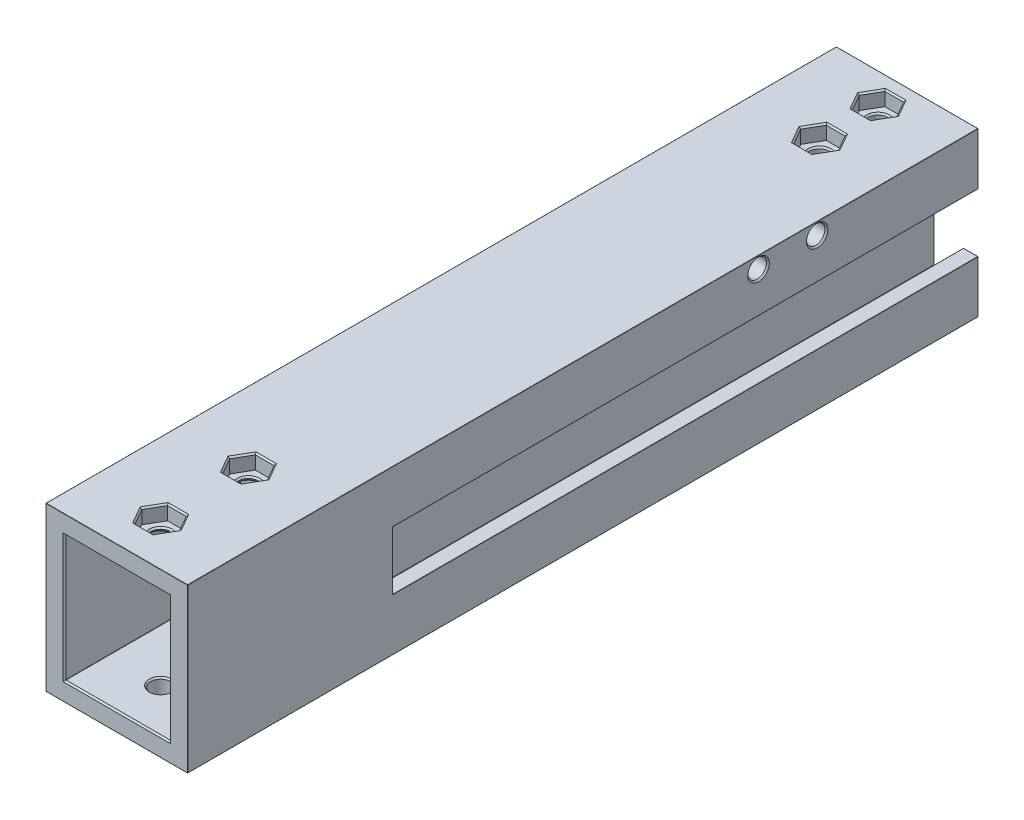
from build123d import *

# Parameters (mm, degrees)
SKETCH1_W           = 48.42
SKETCH1_H           = 55.7
BOSS_EXTRUDE1_DEPTH = 270
SKETCH2_W           = 35.72
SKETCH2_H           = 43
CUT_EXTRUDE1_DEPTH  = 60
SKETCH3_R           = 3.3734375
CUT_EXTRUDE2_DEPTH  = 279.876988832
CUT_EXTRUDE4_DEPTH  = 200
SKETCH11_R          = 3.175
CUT_EXTRUDE5_DEPTH  = 279.711174695
SKETCH12_W          = 15
SKETCH12_H          = 30
CUT_EXTRUDE6_DEPTH  = 50
CUT_EXTRUDE9_DEPTH  = 5
CHAMFER1_SIZE       = 0.5
FILLET7_R           = 0.1


with BuildPart() as part:
    # Sketch1 → Boss-Extrude1 (new body)
    with BuildSketch(Plane.XY):
        with Locations((17.86, 21.5)):
            Rectangle(SKETCH1_W, SKETCH1_H)
    extrude(amount=-BOSS_EXTRUDE1_DEPTH)

    # Sketch2 → Cut-Extrude1 (cut)
    with BuildSketch(Plane.XY):
        with Locations((17.86, 21.5)):
            Rectangle(SKETCH2_W, SKETCH2_H)
    extrude(amount=-CUT_EXTRUDE1_DEPTH, mode=Mode.SUBTRACT)

    # Sketch3 → Cut-Extrude2 (cut, through all)
    with BuildSketch(Plane.XZ.offset(6.35)):
        with Locations((17.86, -260)):
            Circle(SKETCH3_R)
        with Locations((17.86, -240)):
            Circle(SKETCH3_R)
        with Locations((17.86, -45)):
            Circle(SKETCH3_R)
        with Locations((17.86, -15)):
            Circle(SKETCH3_R)
    extrude(amount=-CUT_EXTRUDE2_DEPTH, mode=Mode.SUBTRACT)

    # Sketch8 → Cut-Extrude4 (cut)
    with BuildSketch(Plane(origin=(0, 0, -270), x_dir=(-1, 0, 0), z_dir=(0, 0, -1))):
        Polygon((6.35, 11.5), (1.35, 11.5), (1.35, 1.5), (-8.65, 1.5), (-8.65, 41.5), (1.35, 41.5), (1.35, 31.5), (6.35, 31.5), align=None)
        Polygon((-42.07, 11.5), (-37.07, 11.5), (-37.07, 1.5), (-27.07, 1.5), (-27.07, 41.5), (-37.07, 41.5), (-37.07, 31.5), (-42.07, 31.5), align=None)
    extrude(amount=-CUT_EXTRUDE4_DEPTH, mode=Mode.SUBTRACT)

    # Sketch11 → Cut-Extrude5 (cut, through all)
    with BuildSketch(Plane.ZY.offset(6.35)):
        with Locations((-195, 45.23125)):
            Circle(SKETCH11_R)
        with Locations((-215, 45.23125)):
            Circle(SKETCH11_R)
    extrude(amount=-CUT_EXTRUDE5_DEPTH, mode=Mode.SUBTRACT)

    # Sketch12 → Cut-Extrude6 (cut)
    with BuildSketch(Plane(origin=(0, 0, -270), x_dir=(-1, 0, 0), z_dir=(0, 0, -1))):
        with Locations((-17.86, 21.5)):
            Rectangle(SKETCH12_W, SKETCH12_H)
    extrude(amount=-CUT_EXTRUDE6_DEPTH, mode=Mode.SUBTRACT)

    # Sketch13 → Cut-Extrude9 (cut)
    with BuildSketch(Plane(origin=(0, 49.35, 0), x_dir=(1, 0, 0), z_dir=(0, 1, 0))):
        Polygon((24.275804866, 240), (21.067902433, 245.55625), (14.652097567, 245.55625), (11.444195134, 240), (14.652097567, 234.44375), (21.067902433, 234.44375), align=None)
        Polygon((24.275804866, 260), (21.067902433, 265.55625), (14.652097567, 265.55625), (11.444195134, 260), (14.652097567, 254.44375), (21.067902433, 254.44375), align=None)
        Polygon((24.275804866, 45), (21.067902433, 50.55625), (14.652097567, 50.55625), (11.444195134, 45), (14.652097567, 39.44375), (21.067902433, 39.44375), align=None)
        Polygon((24.275804866, 15), (21.067902433, 20.55625), (14.652097567, 20.55625), (11.444195134, 15), (14.652097567, 9.44375), (21.067902433, 9.44375), align=None)
    extrude(amount=-CUT_EXTRUDE9_DEPTH, mode=Mode.SUBTRACT)

    # Chamfer1
    chamfer1_edges = [part.edges().sort_by_distance(p)[0] for p in [
        (-6.35, 45.23125, -218.175),
        (42.07, 45.23125, -218.175),
        (-6.35, 45.23125, -198.175),
        (42.07, 45.23125, -198.175),
        (14.4865625, 0, -45),
        (14.4865625, -6.35, -45),
        (35.72, 21.5, 0),
        (17.86, 0, 0),
        (17.86, 43, 0),
        (0, 21.5, 0),
        (14.4865625, 43, -45),
        (25.36, 21.5, -270),
        (17.86, 6.5, -270),
        (10.36, 21.5, -270),
        (17.86, 36.5, -270),
        (14.4865625, -6.35, -260),
        (14.4865625, 6.5, -260),
        (14.4865625, 36.5, -260),
        (14.4865625, 0, -15),
        (14.4865625, -6.35, -15),
        (14.4865625, -6.35, -240),
        (14.4865625, 6.5, -240),
        (14.4865625, 36.5, -240),
        (14.4865625, 43, -15),
        (22.67185365, 49.35, -242.778125),
        (22.67185365, 49.35, -237.221875),
        (17.86, 49.35, -234.44375),
        (13.04814635, 49.35, -237.221875),
        (13.04814635, 49.35, -242.778125),
        (17.86, 49.35, -245.55625),
        (13.04814635, 49.35, -257.221875),
        (17.86, 49.35, -254.44375),
        (22.67185365, 49.35, -257.221875),
        (22.67185365, 49.35, -262.778125),
        (17.86, 49.35, -265.55625),
        (13.04814635, 49.35, -262.778125),
        (14.4865625, 44.35, -260),
        (14.4865625, 44.35, -240),
        (22.67185365, 49.35, -17.778125),
        (22.67185365, 49.35, -12.221875),
        (17.86, 49.35, -9.44375),
        (13.04814635, 49.35, -12.221875),
        (13.04814635, 49.35, -17.778125),
        (17.86, 49.35, -20.55625),
        (22.67185365, 49.35, -42.221875),
        (22.67185365, 49.35, -47.778125),
        (17.86, 49.35, -50.55625),
        (13.04814635, 49.35, -47.778125),
        (17.86, 49.35, -39.44375),
        (13.04814635, 49.35, -42.221875),
        (14.4865625, 44.35, -45),
        (14.4865625, 44.35, -15),
    ]]
    chamfer(chamfer1_edges, length=CHAMFER1_SIZE)

    # Fillet7
    fillet7_edges = [part.edges().sort_by_distance(p)[0] for p in [
        (42.07, 11.5, -170),
        (39.57, 11.5, -270),
        (32.07, 1.5, -270),
        (27.07, 1.5, -170),
        (27.07, 21.5, -270),
        (42.07, 31.5, -170),
        (39.57, 31.5, -270),
        (27.07, 41.5, -170),
        (32.07, 41.5, -270),
        (-1.35, 41.5, -170),
        (3.65, 41.5, -270),
        (-1.35, 1.5, -170),
        (3.65, 1.5, -270),
        (8.65, 41.5, -170),
        (8.65, 1.5, -170),
        (8.65, 21.5, -270),
        (17.86, 0, -60),
        (0, 21.5, -60),
        (17.86, 43, -60),
        (35.72, 21.5, -60),
        (17.86, 6.5, -220),
        (25.36, 21.5, -220),
        (17.86, 36.5, -220),
        (10.36, 21.5, -220),
        (37.07, 11.5, -170),
        (37.07, 1.5, -170),
        (37.07, 6.5, -270),
        (37.07, 41.5, -170),
        (37.07, 31.5, -170),
        (37.07, 36.5, -270),
        (39.57, 31.5, -70),
        (37.07, 36.5, -70),
        (32.07, 41.5, -70),
        (27.07, 21.5, -70),
        (32.07, 1.5, -70),
        (37.07, 6.5, -70),
        (39.57, 11.5, -70),
        (42.07, 21.5, -70),
        (-6.35, 31.5, -170),
        (-1.35, 31.5, -170),
        (-3.85, 31.5, -270),
        (-1.35, 11.5, -170),
        (-6.35, 11.5, -170),
        (-3.85, 11.5, -270),
        (-3.85, 11.5, -70),
        (-1.35, 6.5, -70),
        (3.65, 1.5, -70),
        (8.65, 21.5, -70),
        (3.65, 41.5, -70),
        (-1.35, 36.5, -70),
        (-3.85, 31.5, -70),
        (-6.35, 21.5, -70),
        (-1.35, 36.5, -270),
        (42.07, 40.425, -270),
        (42.07, 2.575, -270),
        (-1.35, 6.5, -270),
        (-6.35, 2.575, -270),
        (-6.35, 40.425, -270),
        (17.86, 49.35, -270),
        (17.86, -6.35, -270),
        (-6.35, -6.35, -135),
        (42.07, 49.35, -135),
        (42.07, -6.35, -135),
        (-6.35, 49.35, -135),
        (-6.35, 21.5, 0),
        (17.86, 49.35, 0),
        (17.86, -6.35, 0),
        (42.07, 21.5, 0),
        (0, 0, -30.25),
        (0, 43, -30.25),
        (35.72, 0, -30.25),
        (35.72, 43, -30.25),
        (10.36, 36.5, -244.75),
        (25.36, 36.5, -244.75),
        (10.36, 6.5, -244.75),
        (25.36, 6.5, -244.75),
    ]]
    fillet(fillet7_edges, radius=FILLET7_R)


solid = part.part
